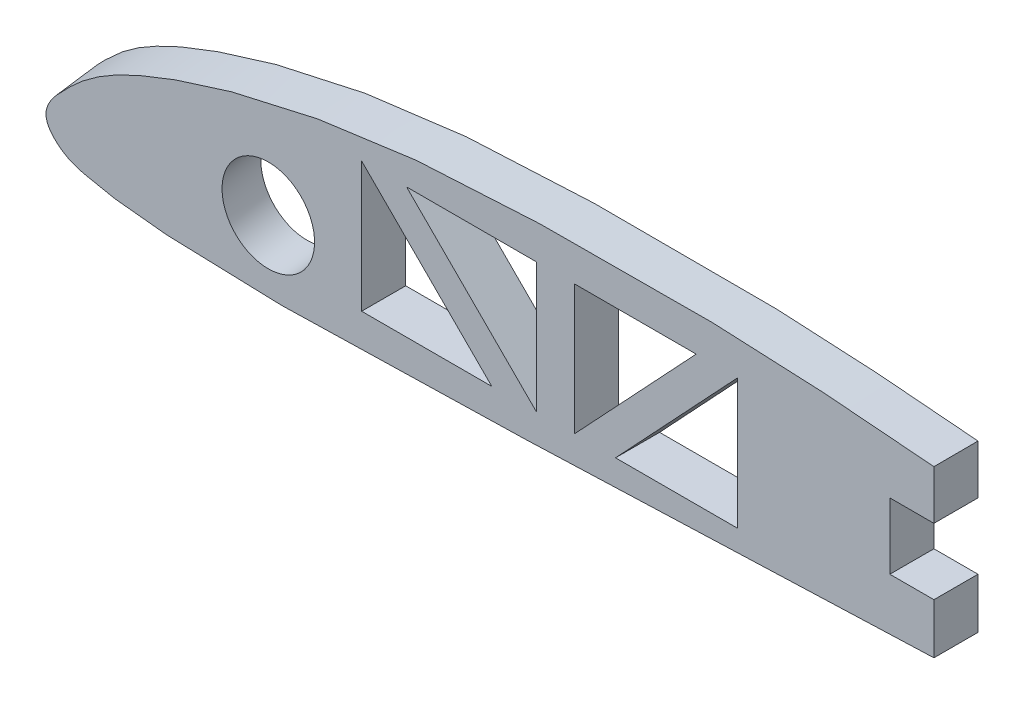
from build123d import *

# Parameters (mm, degrees)
CUT_EXTRUDE_1_DEPTH = 10
SKETCH_4_W          = 2
SKETCH_4_H          = 3
CUT_EXTRUDE_2_DEPTH = 10
CUT_EXTRUDE_3_DEPTH = 10
SKETCH_7_R          = 2.1


with BuildPart() as part:
    # 边界1: read off the stored shape, not the designer's step
    # 边界1: loft between two sections, ruled curve by curve
    other_1_from = [
        Edge.make_bspline([(114.937331636, -0.04882346, 0), (114.909263783, -0.049854411, 0), (114.85134143, -0.051981936, 0), (114.761260929, -0.055290652, 0), (114.671179903, -0.058599386, 0), (114.613395833, -0.060721833, 0), (112.989718365, -0.12036056, 0), (109.798774009, -0.237534241, 0), (105.012470671, -0.413317639, 0), (100.226233707, -0.589088191, 0), (95.440077584, -0.764862829, 0), (91.451666552, -0.911338117, 0), (88.260972262, -1.02855369, 0), (85.867963883, -1.116425904, 0), (83.474968456, -1.204249327, 0), (81.08198578, -1.292063912, 0), (78.689017688, -1.379924953, 0), (76.296069016, -1.467990412, 0), (73.903136856, -1.556195628, 0), (71.510206664, -1.644168762, 0), (69.117262679, -1.731493608, 0), (66.724303332, -1.818146943, 0), (64.331378927, -1.905522708, 0), (61.938540416, -1.995035205, 0), (59.545814496, -2.087297293, 0), (57.551655504, -2.158256735, 0), (55.956068406, -2.207047895, 0), (54.759230882, -2.238446545, 0), (53.562245337, -2.26352327, 0), (52.365116186, -2.280788561, 0), (51.167891154, -2.288400995, 0), (49.970633577, -2.285251593, 0), (48.773494906, -2.26866414, 0), (47.576594519, -2.239068445, 0), (46.380293871, -2.190480921, 0), (45.184609855, -2.130290815, 0), (44.188919761, -2.064363113, 0), (43.395402271, -1.977004846, 0), (42.802732128, -1.892052794, 0), (42.214236504, -1.782094119, 0), (41.626840427, -1.666620747, 0), (41.043157877, -1.532457912, 0), (40.578325894, -1.342441552, 0), (40.245380705, -1.120585385, 0), (40.017067966, -0.926235614, 0), (39.818424575, -0.701085789, 0), (39.663164681, -0.443187584, 0), (39.589070892, -0.147625882, 0), (39.633829271, 0.153397102, 0), (39.758861581, 0.426909679, 0), (39.92440931, 0.676951682, 0), (40.114600417, 0.908396794, 0), (40.318450044, 1.127631521, 0), (40.529626457, 1.33978723, 0), (40.814257609, 1.61948568, 0), (41.182862722, 1.956044221, 0), (41.655867645, 2.323775326, 0), (42.154368698, 2.655792993, 0), (42.672754957, 2.95564976, 0), (43.204397046, 3.231042159, 0), (43.746978436, 3.484213896, 0), (44.297641411, 3.719122364, 0), (44.854403443, 3.939169736, 0), (45.416014704, 4.14646383, 0), (46.169464206, 4.409917164, 0), (47.11915438, 4.716179285, 0), (48.270669411, 5.044477396, 0), (49.4315092, 5.337929871, 0), (50.599694722, 5.600515272, 0), (51.773839703, 5.834982811, 0), (52.953271541, 6.04122519, 0), (54.137440745, 6.218344494, 0), (55.721908615, 6.413660191, 0), (57.710013932, 6.58923836, 0), (60.101230799, 6.718307704, 0), (62.494494042, 6.79756413, 0), (64.888522076, 6.847805149, 0), (67.283123045, 6.858577089, 0), (69.677528907, 6.825059956, 0), (72.070733027, 6.741282808, 0), (74.461957563, 6.613673599, 0), (76.850759037, 6.446634005, 0), (79.236914767, 6.245451535, 0), (81.619988833, 6.010302833, 0), (83.999514235, 5.741624791, 0), (87.166917401, 5.338940803, 0), (91.115957132, 4.759623681, 0), (95.840428876, 3.973210849, 0), (100.550432426, 3.103544354, 0), (105.244280879, 2.150789153, 0), (109.924164858, 1.130890792, 0), (113.031692962, 0.396368607, 0), (114.585190016, 0.028104082, 0)], [0, 0, 0, 0, 0.00055124, 0.001102481, 0.001653721, 0.002204961, 0.002204961, 0.033386056, 0.064567151, 0.095748246, 0.126929341, 0.158110436, 0.173700983, 0.189291531, 0.204882078, 0.220472626, 0.236063173, 0.251653721, 0.267244268, 0.282834816, 0.298425363, 0.314015911, 0.329606458, 0.345197006, 0.360787553, 0.376378101, 0.384173374, 0.391968648, 0.399763922, 0.407559196, 0.415354469, 0.423149743, 0.430945017, 0.438740291, 0.446535564, 0.454330838, 0.462126112, 0.466023749, 0.469921386, 0.473819022, 0.477716659, 0.481614296, 0.485511933, 0.487460752, 0.48940957, 0.491358388, 0.493307207, 0.495256025, 0.497204844, 0.499153662, 0.501102481, 0.503051299, 0.505000117, 0.506948936, 0.508897754, 0.512795391, 0.516693028, 0.520590665, 0.524488302, 0.528385939, 0.532283576, 0.536181212, 0.540078849, 0.543976486, 0.547874123, 0.555669397, 0.563464671, 0.571259944, 0.579055218, 0.586850492, 0.594645765, 0.602441039, 0.610236313, 0.62582686, 0.641417408, 0.657007955, 0.672598503, 0.68818905, 0.703779598, 0.719370145, 0.734960693, 0.75055124, 0.766141788, 0.781732335, 0.797322883, 0.81291343, 0.844094525, 0.87527562, 0.906456715, 0.93763781, 0.968818905, 1, 1, 1, 1], 3),
        Edge.make_bspline([(114.585190016, 0.028104082, 0), (114.937331636, -0.04882346, 0)], [0, 0, 1, 1], 1),
    ]
    other_1_to = [
        Edge.make_bspline([(114.900829426, -0.05016421, -2), (114.87208227, -0.051220112, -2), (114.816682193, -0.053254993, -2), (114.736195369, -0.056211326, -2), (114.655706825, -0.059167722, -2), (114.599850806, -0.06121935, -2), (112.971299393, -0.1210371, -2), (109.770747496, -0.238563533, -2), (104.96984787, -0.414883142, -2), (100.168856378, -0.591195195, -2), (95.367798783, -0.767517866, -2), (91.366857129, -0.914451668, -2), (88.166075944, -1.032039683, -2), (85.765472856, -1.120190589, -2), (83.364854426, -1.208294301, -2), (80.964221905, -1.296388984, -2), (78.563578465, -1.384529056, -2), (76.162930797, -1.47288397, -2), (73.762276765, -1.561372098, -2), (71.361603432, -1.649626344, -2), (68.960896719, -1.737238212, -2), (66.560156009, -1.824171582, -2), (64.15943344, -1.911832005, -2), (61.758781331, -2.001632599, -2), (59.358228247, -2.094197931, -2), (57.357535546, -2.165398044, -2), (55.756714994, -2.214358151, -2), (54.555949266, -2.245867856, -2), (53.355032506, -2.271036131, -2), (52.153969383, -2.28836864, -2), (50.952807767, -2.296017954, -2), (49.751611619, -2.292869902, -2), (48.550532533, -2.276241817, -2), (47.349691374, -2.246559028, -2), (46.149449203, -2.197829903, -2), (44.949826746, -2.137437545, -2), (43.950851955, -2.071325539, -2), (43.154719667, -1.983683161, -2), (42.560085429, -1.898515641, -2), (41.969664388, -1.788104375, -2), (41.380298135, -1.672447242, -2), (40.794708959, -1.537778246, -2), (40.32833038, -1.34712883, -2), (39.994259051, -1.124616182, -2), (39.765181464, -0.929620646, -2), (39.565859981, -0.703760197, -2), (39.410063035, -0.445020776, -2), (39.335683249, -0.148498314, -2), (39.38056197, 0.153525593, -2), (39.505999299, 0.427942995, -2), (39.672091204, 0.678811487, -2), (39.862910721, 0.911018686, -2), (40.067434177, 1.130975087, -2), (40.279308138, 1.343829248, -2), (40.564879113, 1.624448977, -2), (40.934705919, 1.962110793, -2), (41.409280622, 2.331041915, -2), (41.909436129, 2.664138364, -2), (42.429540502, 2.964968541, -2), (42.962943253, 3.241253878, -2), (43.507320679, 3.495244738, -2), (44.059804821, 3.730913735, -2), (44.618407252, 3.951673263, -2), (45.181873873, 4.159638617, -2), (45.93781101, 4.423946725, -2), (46.890637116, 4.731196503, -2), (48.045952864, 5.060548033, -2), (49.210621731, 5.35493913, -2), (50.382658133, 5.618361399, -2), (51.560671454, 5.85357176, -2), (52.743987025, 6.060460053, -2), (53.932053264, 6.238125261, -2), (55.521731563, 6.434030214, -2), (57.516365326, 6.610128559, -2), (59.915420027, 6.739565241, -2), (62.316513131, 6.819052674, -2), (64.718359184, 6.86942576, -2), (67.120764043, 6.880190831, -2), (69.52295518, 6.846512323, -2), (71.923921137, 6.762409684, -2), (74.322880539, 6.634339246, -2), (76.719387435, 6.466716885, -2), (79.113217062, 6.264846164, -2), (81.503930493, 6.028901089, -2), (83.891057986, 5.759322481, -2), (87.068544205, 5.355301884, -2), (91.03008586, 4.774096704, -2), (95.769393141, 3.985166008, -2), (100.494052892, 3.112748504, -2), (105.202365188, 2.157027174, -2), (109.89651629, 1.133997726, -2), (113.013410232, 0.397258288, -2), (114.571560321, 0.027890737, -2)], [0, 0, 0, 0, 0.00055124, 0.001102481, 0.001653721, 0.002204961, 0.002204961, 0.033386056, 0.064567151, 0.095748246, 0.126929341, 0.158110436, 0.173700983, 0.189291531, 0.204882078, 0.220472626, 0.236063173, 0.251653721, 0.267244268, 0.282834816, 0.298425363, 0.314015911, 0.329606458, 0.345197006, 0.360787553, 0.376378101, 0.384173374, 0.391968648, 0.399763922, 0.407559196, 0.415354469, 0.423149743, 0.430945017, 0.438740291, 0.446535564, 0.454330838, 0.462126112, 0.466023749, 0.469921386, 0.473819022, 0.477716659, 0.481614296, 0.485511933, 0.487460752, 0.48940957, 0.491358388, 0.493307207, 0.495256025, 0.497204844, 0.499153662, 0.501102481, 0.503051299, 0.505000117, 0.506948936, 0.508897754, 0.512795391, 0.516693028, 0.520590665, 0.524488302, 0.528385939, 0.532283576, 0.536181212, 0.540078849, 0.543976486, 0.547874123, 0.555669397, 0.563464671, 0.571259944, 0.579055218, 0.586850492, 0.594645765, 0.602441039, 0.610236313, 0.62582686, 0.641417408, 0.657007955, 0.672598503, 0.68818905, 0.703779598, 0.719370145, 0.734960693, 0.75055124, 0.766141788, 0.781732335, 0.797322883, 0.81291343, 0.844094525, 0.87527562, 0.906456715, 0.93763781, 0.968818905, 1, 1, 1, 1], 3),
        Edge.make_bspline([(114.571560321, 0.027890737, -2), (114.900829426, -0.05016421, -2)], [0, 0, 1, 1], 1),
    ]
    other_1 = Solid(Shell([*[Face.make_surface_from_curves(other_1_from[k], other_1_to[k]) for k in range(2)], Face(Wire(other_1_from)), Face(Wire(other_1_to))]))
    add(other_1)

    # 草图3 → 切除-拉伸1 (cut)
    with BuildSketch(Plane(origin=(0, 0, -2), x_dir=(-1.0, 0, -1.4973603289952708e-12), z_dir=(1.4973603289952708e-12, -4.07659645441212e-11, -1.0))):
        with BuildLine():
            add(Edge.make_bspline(
                [(-114.571560321, 0.027890737), (-114.900829426, -0.05016421)],
                knots=[0, 0, 1, 1], degree=1))
            Line((-114.900829426, -0.05016421), (-79.900829426, -0.05016421))
            Line((-79.900829426, -0.05016421), (-79.900829426, 6.185185017))
            add(Edge.make_bspline(
                [(-79.900829426, 6.185185017), (-80.43525017, 6.133756556), (-81.766133376, 5.999290485), (-83.891057986, 5.759322481), (-87.068544205, 5.355301884), (-91.03008586, 4.774096704), (-95.769393141, 3.985166008), (-100.494052892, 3.112748504), (-105.202365188, 2.157027174), (-109.89651629, 1.133997726), (-113.013410232, 0.397258288), (-114.571560321, 0.027890737)],
                knots=[0.771279201, 0.771279201, 0.771279201, 0.771279201, 0.781732335, 0.797322883, 0.81291343, 0.844094525, 0.87527562, 0.906456715, 0.93763781, 0.968818905, 1, 1, 1, 1], degree=3))
        make_face()
        with BuildLine():
            Line((-79.900829426, -0.05016421), (-114.900829426, -0.05016421))
            add(Edge.make_bspline(
                [(-114.900829426, -0.05016421), (-114.87208227, -0.051220112), (-114.816682193, -0.053254993), (-114.736195369, -0.056211326), (-114.655706825, -0.059167722), (-114.599850806, -0.06121935), (-112.971299393, -0.1210371), (-109.770747496, -0.238563533), (-104.96984787, -0.414883142), (-100.168856378, -0.591195195), (-95.367798783, -0.767517866), (-91.366857129, -0.914451668), (-88.166075944, -1.032039683), (-85.765472856, -1.120190589), (-83.364854426, -1.208294301), (-81.409970323, -1.280031601), (-80.255293272, -1.322419758), (-79.900829426, -1.335436043)],
                knots=[0, 0, 0, 0, 0.00055124, 0.001102481, 0.001653721, 0.002204961, 0.002204961, 0.033386056, 0.064567151, 0.095748246, 0.126929341, 0.158110436, 0.173700983, 0.189291531, 0.204882078, 0.220472626, 0.227378635, 0.227378635, 0.227378635, 0.227378635], degree=3))
            Line((-79.900829426, -1.335436043), (-79.900829426, -0.05016421))
        make_face()
        with BuildLine():
            add(Edge.make_bspline(
                [(-114.900829426, -0.05016421), (-114.87208227, -0.051220112), (-114.816682193, -0.053254993), (-114.736195369, -0.056211326), (-114.655706825, -0.059167722), (-114.599850806, -0.06121935), (-112.971299393, -0.1210371), (-109.770747496, -0.238563533), (-104.96984787, -0.414883142), (-100.168856378, -0.591195195), (-95.367798783, -0.767517866), (-91.366857129, -0.914451668), (-88.166075944, -1.032039683), (-85.765472856, -1.120190589), (-83.364854426, -1.208294301), (-81.409970323, -1.280031601), (-80.255293272, -1.322419758), (-79.900829426, -1.335436043)],
                knots=[0, 0, 0, 0, 0.00055124, 0.001102481, 0.001653721, 0.002204961, 0.002204961, 0.033386056, 0.064567151, 0.095748246, 0.126929341, 0.158110436, 0.173700983, 0.189291531, 0.204882078, 0.220472626, 0.227378635, 0.227378635, 0.227378635, 0.227378635], degree=3))
            add(Edge.make_bspline(
                [(-114.571560321, 0.027890737), (-114.900829426, -0.05016421)],
                knots=[0, 0, 1, 1], degree=1))
            add(Edge.make_bspline(
                [(-79.900829426, 6.185185017), (-80.43525017, 6.133756556), (-81.766133376, 5.999290485), (-83.891057986, 5.759322481), (-87.068544205, 5.355301884), (-91.03008586, 4.774096704), (-95.769393141, 3.985166008), (-100.494052892, 3.112748504), (-105.202365188, 2.157027174), (-109.89651629, 1.133997726), (-113.013410232, 0.397258288), (-114.571560321, 0.027890737)],
                knots=[0.771279201, 0.771279201, 0.771279201, 0.771279201, 0.781732335, 0.797322883, 0.81291343, 0.844094525, 0.87527562, 0.906456715, 0.93763781, 0.968818905, 1, 1, 1, 1], degree=3))
            Line((-79.900829426, 6.185185017), (-79.900829426, 14.246908059))
            Line((-79.900829426, 14.246908059), (-118.111413569, 14.246908059))
            Line((-118.111413569, 14.246908059), (-118.111413569, -7.368160655))
            Line((-118.111413569, -7.368160655), (-79.900829426, -7.368160655))
            Line((-79.900829426, -7.368160655), (-79.900829426, -1.335436043))
        make_face()
    extrude(amount=-CUT_EXTRUDE_1_DEPTH, mode=Mode.SUBTRACT)

    # 草图4 → 切除-拉伸2 (cut)
    with BuildSketch(Plane(origin=(0, 0, -2), x_dir=(-1.0, 0, -1.4973603289952708e-12), z_dir=(1.4973603289952708e-12, -4.07659645441212e-11, -1.0))):
        with Locations((-78.900829414, 2.44983579)):
            Rectangle(SKETCH_4_W, SKETCH_4_H)
    extrude(amount=-CUT_EXTRUDE_2_DEPTH, mode=Mode.SUBTRACT)

    # 草图5 → 切除-拉伸3 (cut)
    with BuildSketch(Plane(origin=(0, 0, -2), x_dir=(-1.0, 0, -1.4973603289952708e-12), z_dir=(1.4973603289952708e-12, -4.07659645441212e-11, -1.0))):
        Polygon((-69.111298956, 5.206059468), (-63.580020582, 5.206059468), (-63.580020582, -0.699515939), align=None)
        Polygon((-61.874889654, 5.206059468), (-55.969314247, 5.206059468), (-61.874889654, -0.699515939), align=None)
        Polygon((-59.837050253, -0.699515939), (-53.931474846, 5.206059468), (-53.931474846, -0.699515939), align=None)
        Polygon((-70.98278412, 5.206059468), (-65.451505746, -0.699515939), (-70.98278412, -0.699515939), align=None)
    extrude(amount=-CUT_EXTRUDE_3_DEPTH, mode=Mode.SUBTRACT)

    # 切除-扫描1: sweep along a path in 草图8
    with BuildLine(Plane(origin=(114.900829426, -0.05016421, -329), x_dir=(1, 0, 0), z_dir=(0, 1, 0))) as sweep_1_path:
        Line((-200, 0), (-160.4, -329))
    # 草图7 → 切除-扫描1 (sweep, cut)
    with BuildSketch(Plane(origin=(114.900829426, -0.05016421, -329), x_dir=(-1, 0, 0), z_dir=(0, 0, -1))):
        with Locations((104.805246224, 1)):
            Circle(SKETCH_7_R)
    sweep(path=sweep_1_path.line, mode=Mode.SUBTRACT)


solid = part.part
